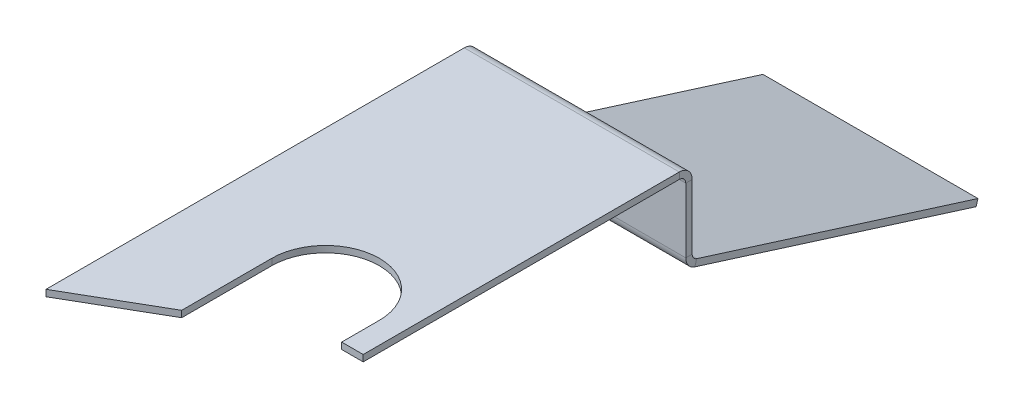
from build123d import *

# Parameters (mm, degrees)
SM_BASE_FLANGE_1_DEPTH = 100
CUT_EXTRUDE_1_REACH    = 696.392


# Sheet-metal steps are written as plain solids
with BuildPart() as part:
    # Sketch 1 → 基体-法兰1 (new, symmetric)
    with BuildSketch(Plane(origin=(0, 0, 0), x_dir=(0, 0, -1), z_dir=(1, 0, 0))):
        with BuildLine():
            Line((0, 0), (389, 0))
            ThreePointArc((389, 0), (393.242640687, -1.757359313), (395, -6))
            Line((395, -6), (395, -66.197173462))
            ThreePointArc((395, -66.197173462), (397.324227007, -73.295019402), (403.396569497, -77.643364471))
            Line((403.396569497, -77.643364471), (665, -160))
            Line((665, -160), (666.801715251, -154.276904496))
            Line((666.801715251, -154.276904496), (405.198284749, -71.920268967))
            ThreePointArc((405.198284749, -71.920268967), (402.162113503, -69.746096432), (401, -66.197173462))
            Line((401, -66.197173462), (401, -6))
            ThreePointArc((401, -6), (397.485281374, 2.485281374), (389, 6))
            Line((389, 6), (0, 6))
            Line((0, 6), (0, 0))
        make_face()
    extrude(amount=SM_BASE_FLANGE_1_DEPTH, both=True)

    # 草图4 → 切除-拉伸1 (cut, up to next)
    with BuildSketch(Plane(origin=(0, 6, 0), x_dir=(1, 0, 0), z_dir=(0, 1, 0)), mode=Mode.PRIVATE) as cut_extrude_1_sk1:
        with BuildLine():
            Line((-20, 130), (-20, 46.188021535))
            Line((-20, 46.188021535), (-100, 0))
            Line((-100, 0), (100, 0))
            Line((100, 0), (100, 95))
            Line((100, 95), (80, 95))
            Line((80, 95), (80, 130))
            ThreePointArc((80, 130), (30, 180), (-20, 130))
        make_face()
    cut_extrude_1_tool1 = extrude(cut_extrude_1_sk1.sketch, amount=-CUT_EXTRUDE_1_REACH, mode=Mode.PRIVATE) & part.part
    add(cut_extrude_1_tool1.solids().sort_by_distance((28.66293, 6, -75.336076))[0], mode=Mode.SUBTRACT)


solid = part.part
